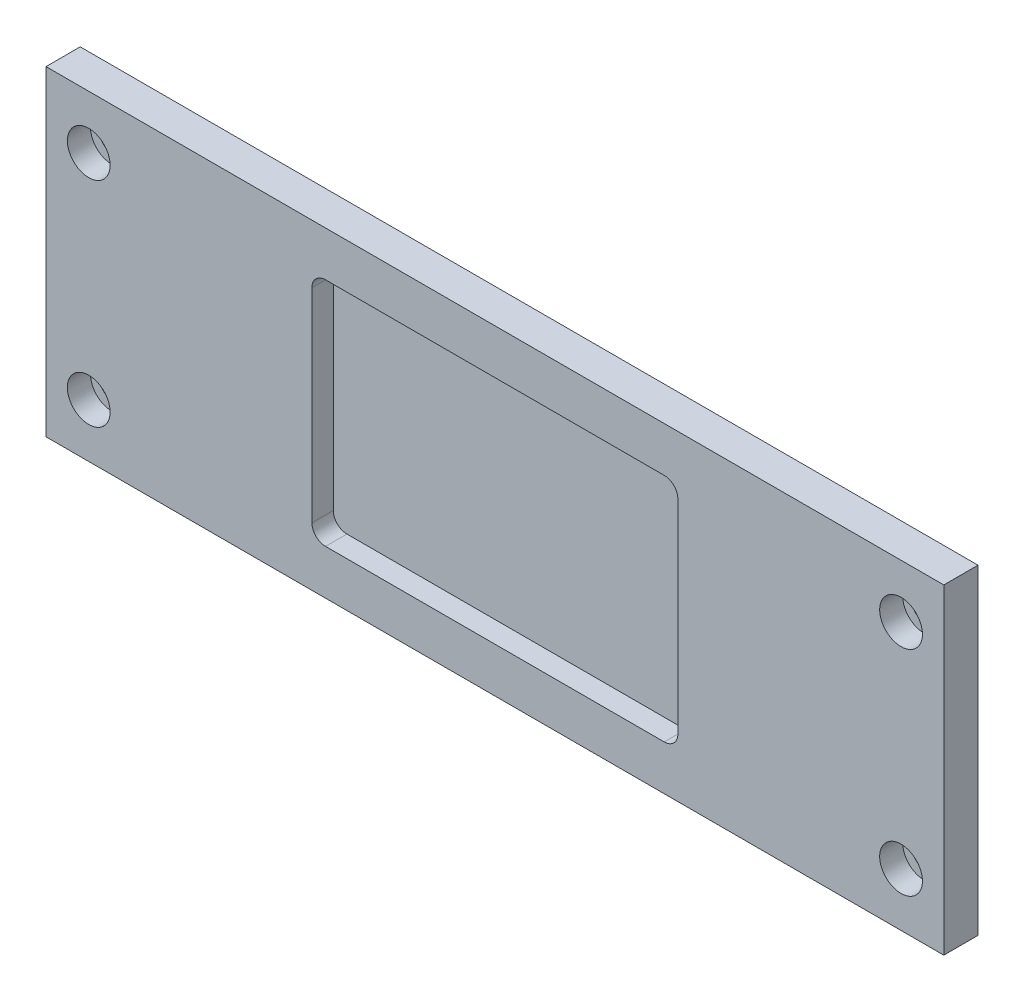
from build123d import *

# Parameters (mm, degrees)
SKETCH_1_W                   = 210
SKETCH_1_H                   = 75
EXTRUDE_1_DEPTH              = 8
CUT_EXTRUDE_1_DEPTH          = 5
HOLE_WIZARD_M5_1_D           = 5.5
HOLE_WIZARD_M5_1_DEPTH       = 10.1
HOLE_WIZARD_M5_1_CBORE_D     = 10
HOLE_WIZARD_M5_1_CBORE_DEPTH = 5.4
HOLE_WIZARD_M5_1_TIP         = 1.652366702


with BuildPart() as part:
    # 草图1 → 凸台-拉伸1 (new body)
    with BuildSketch(Plane.XY):
        with Locations((105, 37.5)):
            Rectangle(SKETCH_1_W, SKETCH_1_H)
    extrude(amount=EXTRUDE_1_DEPTH)

    # 草图2 → 切除-拉伸1 (cut)
    with BuildSketch(Plane.XY.offset(8)):
        with BuildLine():
            Line((144.62, 64.5), (65.38, 64.5))
            ThreePointArc((65.38, 64.5), (63.131400436, 63.568599564), (62.2, 61.32))
            Line((62.2, 61.32), (62.2, 13.68))
            ThreePointArc((62.2, 13.68), (63.131400436, 11.431400436), (65.38, 10.5))
            Line((65.38, 10.5), (144.62, 10.5))
            ThreePointArc((144.62, 10.5), (146.868599564, 11.431400436), (147.8, 13.68))
            Line((147.8, 13.68), (147.8, 61.32))
            ThreePointArc((147.8, 61.32), (146.868599564, 63.568599564), (144.62, 64.5))
        make_face()
    extrude(amount=-CUT_EXTRUDE_1_DEPTH, mode=Mode.SUBTRACT)

    # M5 六角凹头螺钉的柱形沉头孔1
    with Locations(Plane.XY.offset(8)):
        with Locations((10, 62.5), (10, 12.5), (200, 62.5), (200, 12.5)):
            CounterBoreHole(HOLE_WIZARD_M5_1_D / 2, HOLE_WIZARD_M5_1_CBORE_D / 2, HOLE_WIZARD_M5_1_CBORE_DEPTH, depth=HOLE_WIZARD_M5_1_DEPTH)
            with Locations((0, 0, -(HOLE_WIZARD_M5_1_DEPTH + HOLE_WIZARD_M5_1_TIP / 2))):  # 118° drill point
                Cone(0, HOLE_WIZARD_M5_1_D / 2, HOLE_WIZARD_M5_1_TIP, mode=Mode.SUBTRACT)


solid = part.part
